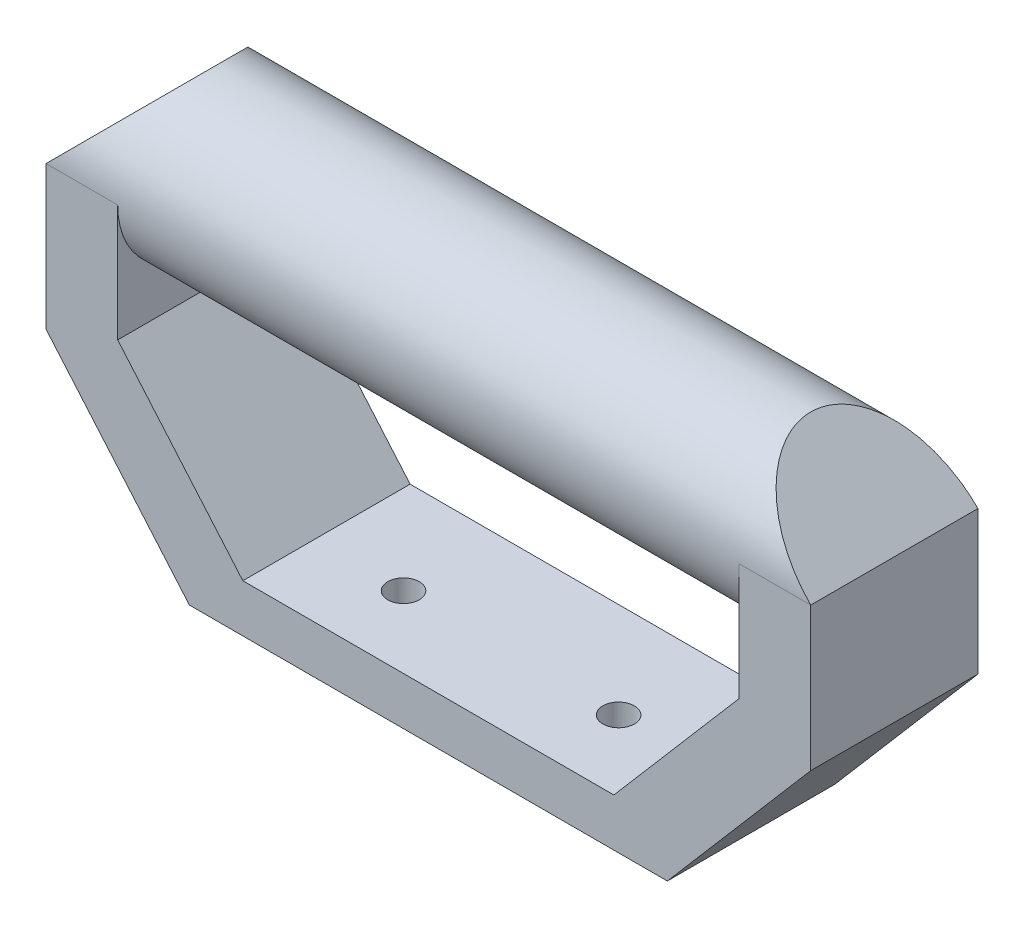
from build123d import *

# Parameters (mm, degrees)
SKETCH1_W                = 100
SKETCH1_H                = 35
BOSS_EXTRUDE1_DEPTH      = 10
BOSS_EXTRUDE2_DEPTH      = 35
SKETCH3_R                = 17.5
BOSS_EXTRUDE3_DEPTH      = 130
CHAMFER1_SIZE            = 15
CUT_EXTRUDE1_DEPTH       = 158.896326746
M6_CLEARANCE_HOLE1_D     = 6.6
M6_CLEARANCE_HOLE1_DEPTH = 10


with BuildPart() as part:
    # Sketch1 → Boss-Extrude1 (new body)
    with BuildSketch(Plane(origin=(0, 0, 0), x_dir=(1, 0, 0), z_dir=(0, 1, 0))):
        with Locations((50, 17.5)):
            Rectangle(SKETCH1_W, SKETCH1_H)
    extrude(amount=BOSS_EXTRUDE1_DEPTH)

    # Sketch2 → Boss-Extrude2 (add)
    with BuildSketch(Plane.XY):
        Polygon((0, 0), (-30, 35), (-30, 65), (-15, 65), (-15, 40.548861143), (11.184738123, 10), align=None)
        Polygon((115, 40.548861143), (88.815261877, 10), (100, 0), (130, 35), (130, 65), (115, 65), align=None)
    extrude(amount=-BOSS_EXTRUDE2_DEPTH)

    # Sketch3 → Boss-Extrude3 (add)
    with BuildSketch(Plane.ZY.offset(-115)):
        with Locations(Location((-17.5, 65, 0), (0, 0, 180))):
            Circle(SKETCH3_R)
    extrude(amount=BOSS_EXTRUDE3_DEPTH)

    # Chamfer1
    # the kernel refuses this chamfer: 15 mm, written as the material it adds along each edge
    with BuildSketch(Plane(origin=(-15, 65, 38.575244819), x_dir=(-0.9996219169112968, -0.02749587661058678, 0), z_dir=(0, 0, -1))) as chamfer1_piece_1_section:
        Polygon((CHAMFER1_SIZE * 0.999621916911, CHAMFER1_SIZE * 0.0274958766106), (-CHAMFER1_SIZE * 0.0274958766106, CHAMFER1_SIZE * 0.999621916911), (0, 0), align=None)
    chamfer1_piece_1 = extrude(amount=112.150489639, mode=Mode.PRIVATE)
    chamfer1_piece_1 = chamfer1_piece_1 & Plane(origin=(-20.149822061, 65, -17.5), x_dir=(0, 0, -1), z_dir=(1, 0, 0)) * Cylinder(17.5, 285, mode=Mode.PRIVATE)
    add(chamfer1_piece_1)
    with BuildSketch(Plane(origin=(115, 65, 38.575244819), x_dir=(0.9996219169112966, -0.02749587661058679, 0), z_dir=(0, 0, -1))) as chamfer1_piece_2_section:
        Polygon((CHAMFER1_SIZE * 0.999621916911, -CHAMFER1_SIZE * 0.0274958766106), (-CHAMFER1_SIZE * 0.0274958766106, -CHAMFER1_SIZE * 0.999621916911), (0, 0), align=None)
    chamfer1_piece_2 = extrude(amount=112.150489639, mode=Mode.PRIVATE)
    chamfer1_piece_2 = chamfer1_piece_2 & Plane(origin=(120.149822061, 65, -17.5), x_dir=(0, 0, -1), z_dir=(1, 0, 0)) * Cylinder(17.5, 285, mode=Mode.PRIVATE)
    add(chamfer1_piece_2)

    # Sketch4 → Cut-Extrude1 (cut, through all)
    with BuildSketch(Plane(origin=(0, 0, -35), x_dir=(-1, 0, 0), z_dir=(0, 0, -1))):
        Polygon((-130, 65), (-112.5, 82.5), (-130, 82.5), align=None)
        Polygon((12.5, 82.5), (30, 82.5), (30, 65), align=None)
    extrude(amount=-CUT_EXTRUDE1_DEPTH, mode=Mode.SUBTRACT)

    # M6 Clearance Hole1
    with Locations(Plane(origin=(0, 10, 0), x_dir=(1, 0, 0), z_dir=(0, 1, 0))):
        with Locations((29.805261877, 15), (74.805261877, 15)):
            Hole(M6_CLEARANCE_HOLE1_D / 2, depth=M6_CLEARANCE_HOLE1_DEPTH)


solid = part.part
